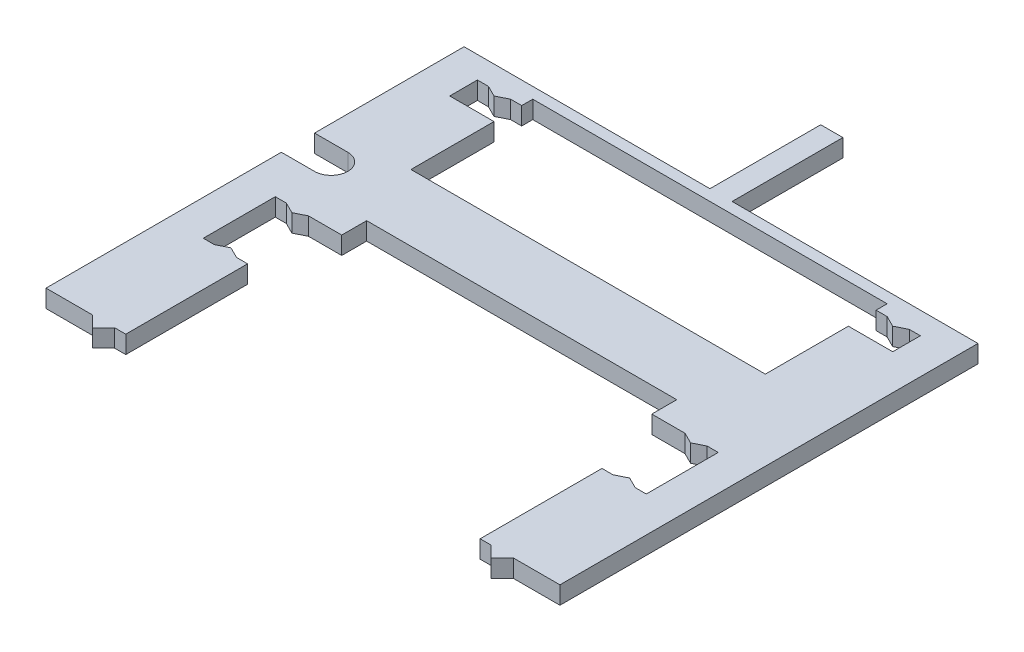
from build123d import *

# Parameters (mm, degrees)
BOSS_EXTRUDE1_DEPTH = 1.6


with BuildPart() as part:
    # Sketch1 → Boss-Extrude1 (new body)
    with BuildSketch(Plane(origin=(0, 0, 0), x_dir=(1, 0, 0), z_dir=(0, 1, 0))):
        with BuildLine():
            Line((-65.832583289, 0), (-61.629583289, 0))
            Line((-61.629583289, 0), (-60.629583289, -1))
            Line((-60.629583289, -1), (-59.629583289, 0))
            Line((-59.629583289, 0), (-58.629583289, 0))
            Line((-58.629583289, 0), (-58.629583289, 11))
            Line((-58.629583289, 11), (-59.629583289, 11))
            Line((-59.629583289, 11), (-60.629583289, 11.5))
            Line((-60.629583289, 11.5), (-61.629583289, 11))
            Line((-61.629583289, 11), (-62.629583289, 11))
            Line((-62.629583289, 11), (-62.629583289, 17.5))
            Line((-62.629583289, 17.5), (-61.629583289, 17.5))
            Line((-61.629583289, 17.5), (-60.629583289, 17))
            Line((-60.629583289, 17), (-59.629583289, 17.5))
            Line((-59.629583289, 17.5), (-56.629583289, 17.5))
            Line((-56.629583289, 17.5), (-56.629583289, 19.75))
            Line((-56.629583289, 19.75), (-28.629583289, 19.75))
            Line((-28.629583289, 19.75), (-28.629583289, 17.5))
            Line((-28.629583289, 17.5), (-25.629583289, 17.5))
            Line((-25.629583289, 17.5), (-24.629583289, 17))
            Line((-24.629583289, 17), (-23.629583289, 17.5))
            Line((-23.629583289, 17.5), (-22.629583289, 17.5))
            Line((-22.629583289, 17.5), (-22.629583289, 11))
            Line((-22.629583289, 11), (-23.629583289, 11))
            Line((-23.629583289, 11), (-24.629583289, 11.5))
            Line((-24.629583289, 11.5), (-25.629583289, 11))
            Line((-25.629583289, 11), (-26.629583289, 11))
            Line((-26.629583289, 11), (-26.629583289, 0))
            Line((-26.629583289, 0), (-25.629583289, 0))
            Line((-25.629583289, 0), (-24.629583289, -1))
            Line((-24.629583289, -1), (-23.629583289, 0))
            Line((-23.629583289, 0), (-19.426583289, 0))
            Line((-19.426583289, 0), (-19.426583289, 37.75))
            Line((-19.426583289, 37.75), (-41.629583289, 37.75))
            Line((-41.629583289, 37.75), (-41.629583289, 47.75))
            Line((-41.629583289, 47.75), (-43.629583289, 47.75))
            Line((-43.629583289, 47.75), (-43.629583289, 37.75))
            Line((-43.629583289, 37.75), (-65.832583289, 37.75))
            Line((-65.832583289, 37.75), (-65.832583289, 24.25))
            Line((-65.832583289, 24.25), (-62.832583289, 24.25))
            ThreePointArc((-62.832583289, 24.25), (-61.332583289, 22.75), (-62.832583289, 21.25))
            Line((-62.832583289, 21.25), (-65.832583289, 21.25))
            Line((-65.832583289, 21.25), (-65.832583289, 0))
        make_face()
        Polygon((-26.629583289, 25.75), (-58.629583289, 25.75), (-58.629583289, 33.25), (-62.629583289, 33.25), (-62.629583289, 35.75), (-61.629583289, 35.75), (-60.629583289, 35.25), (-59.629583289, 35.75), (-58.629583289, 35.75), (-58.629583289, 36.75), (-26.629583289, 36.75), (-26.629583289, 35.75), (-25.629583289, 35.75), (-24.629583289, 35.25), (-23.629583289, 35.75), (-22.629583289, 35.75), (-22.629583289, 33.25), (-26.629583289, 33.25), align=None, mode=Mode.SUBTRACT)
    extrude(amount=BOSS_EXTRUDE1_DEPTH)


solid = part.part
